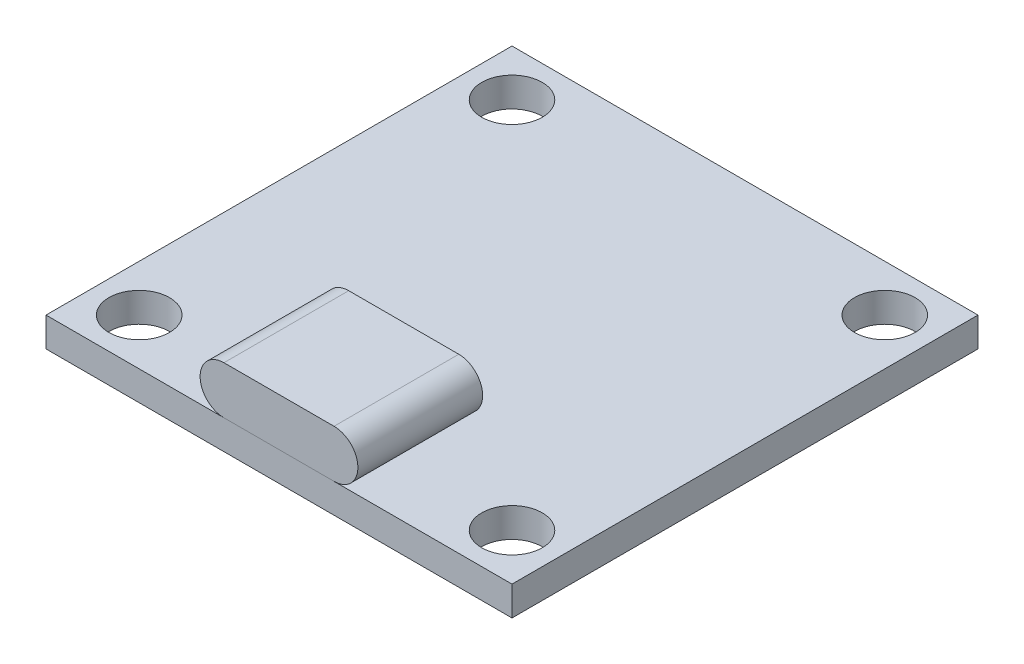
from build123d import *

# Parameters (mm, degrees)
SKETCH2_W             = 25.4
SKETCH2_H             = 25.4
BOSS_EXTRUDE1_DEPTH   = 0.8
CUT_EXTRUDE2_REACH    = 20.032
SKETCH5_R             = 1.65
CRVPATTERN1_START     = -0.8
CRVPATTERN1_OUTLINE_R = 1.65
CRVPATTERN1_DEPTH     = 1.6
BOSS_EXTRUDE2_DEPTH   = 6.8


# Read off the part's stored shape, not the designer's step: CrvPattern1
with BuildPart() as part:
    # Sketch2 → Boss-Extrude1 (new, symmetric)
    with BuildSketch(Plane(origin=(0, 0, 0), x_dir=(1, 0, 0), z_dir=(0, 1, 0))):
        Rectangle(SKETCH2_W, SKETCH2_H)
    extrude(amount=BOSS_EXTRUDE1_DEPTH, both=True)

    # Sketch5 → Cut-Extrude2 (cut, up to next)
    with BuildSketch(Plane(origin=(0, 0.8, 0), x_dir=(1, 0, 0), z_dir=(0, 1, 0)), mode=Mode.PRIVATE) as cut_extrude2_sk1:
        with Locations(Location((-10.16, -10.16, 0), (0, 0, 270))):
            Circle(SKETCH5_R)
    cut_extrude2_tool1 = extrude(cut_extrude2_sk1.sketch, amount=-CUT_EXTRUDE2_REACH, mode=Mode.PRIVATE) & part.part
    add(cut_extrude2_tool1.solids().sort_by_distance((-10.16, 0.8, 10.16))[0], mode=Mode.SUBTRACT)

    # CrvPattern1 outline → CrvPattern1 (cut)
    with BuildSketch(Plane(origin=(0, 0, 0), x_dir=(1, 0, 0), z_dir=(0, 1, 0)).offset(CRVPATTERN1_START)):
        with Locations((10.16, 10.16)):
            Circle(CRVPATTERN1_OUTLINE_R)
        with Locations((-10.16, 10.16)):
            Circle(CRVPATTERN1_OUTLINE_R)
        with Locations((10.16, -10.16)):
            Circle(CRVPATTERN1_OUTLINE_R)
    extrude(amount=CRVPATTERN1_DEPTH, mode=Mode.SUBTRACT)


with BuildPart() as body_2:
    # Sketch6 → Boss-Extrude2 (new body)
    with BuildSketch(Plane.XY.offset(12.7)):
        with BuildLine():
            Line((-3, 3.4), (3, 3.4))
            ThreePointArc((3, 3.4), (4.3, 2.1), (3, 0.8))
            Line((3, 0.8), (-3, 0.8))
            ThreePointArc((-3, 0.8), (-4.3, 2.1), (-3, 3.4))
        make_face()
    extrude(amount=-BOSS_EXTRUDE2_DEPTH)


solid = Compound([part.part, body_2.part])
